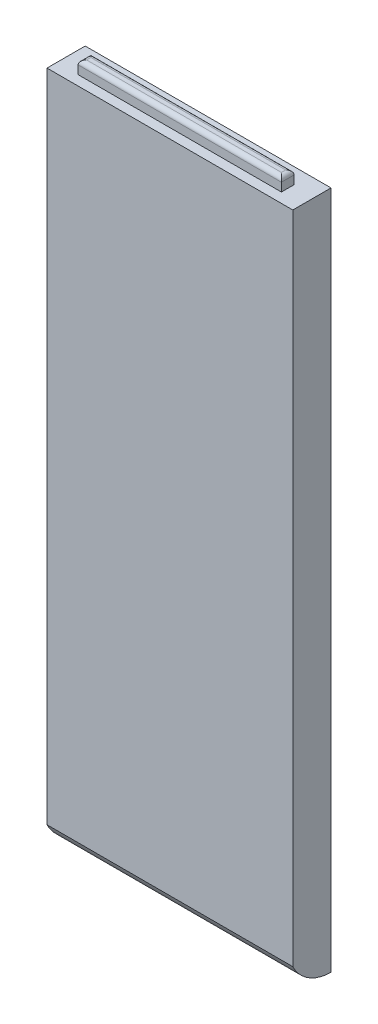
from build123d import *

# Parameters (mm, degrees)
SKETCH1_W           = 57.9
SKETCH1_H           = 160
BOSS_EXTRUDE2_DEPTH = 10
FILLET2_R           = 10
SKETCH2_W           = 47.9
SKETCH2_H           = 2.3
BOSS_EXTRUDE3_DEPTH = 3
FILLET3_R           = 1
SKETCH4_W           = 47.9
SKETCH4_H           = 3
BOSS_EXTRUDE4_DEPTH = 3
FILLET4_R           = 1
SKETCH5_W           = 57.9
SKETCH5_H           = 160
CUT_EXTRUDE1_DEPTH  = 1


with BuildPart() as part:
    # Sketch1 → Boss-Extrude2 (new body)
    with BuildSketch(Plane.XY):
        with Locations((28.95, 80)):
            Rectangle(SKETCH1_W, SKETCH1_H)
    extrude(amount=BOSS_EXTRUDE2_DEPTH)

    # Fillet2
    fillet2_edges = [part.edges().sort_by_distance(p)[0] for p in [
        (28.95, 0, 10),
    ]]
    fillet(fillet2_edges, radius=FILLET2_R - 0.0001)  # a hair under: the kernel refuses the full size

    # Sketch2 → Boss-Extrude3 (add)
    with BuildSketch(Plane(origin=(0, 0, 0), x_dir=(-1, 0, 0), z_dir=(0, 0, -1))):
        with Locations((-28.95, 2.5)):
            Rectangle(SKETCH2_W, SKETCH2_H)
    extrude(amount=BOSS_EXTRUDE3_DEPTH)

    # Fillet3
    fillet3_edges = [part.edges().sort_by_distance(p)[0] for p in [
        (52.9, 2.5, -3),
        (28.95, 1.35, -3),
        (5, 2.5, -3),
        (28.95, 3.65, -3),
    ]]
    fillet(fillet3_edges, radius=FILLET3_R)

    # Sketch4 → Boss-Extrude4 (add)
    with BuildSketch(Plane(origin=(0, 160, 0), x_dir=(1, 0, 0), z_dir=(0, 1, 0))):
        with Locations((28.95, -5.180907412)):
            Rectangle(SKETCH4_W, SKETCH4_H)
    extrude(amount=BOSS_EXTRUDE4_DEPTH)

    # Fillet4
    fillet4_edges = [part.edges().sort_by_distance(p)[0] for p in [
        (5, 163, 5.180907412),
        (28.95, 163, 6.680907412),
        (52.9, 163, 5.180907412),
        (28.95, 163, 3.680907412),
    ]]
    fillet(fillet4_edges, radius=FILLET4_R)

    # Sketch5 → Cut-Extrude1 (cut)
    with BuildSketch(Plane.XY.offset(10)):
        with Locations((28.95, 80)):
            Rectangle(SKETCH5_W, SKETCH5_H)
    extrude(amount=-CUT_EXTRUDE1_DEPTH, mode=Mode.SUBTRACT)


solid = part.part
